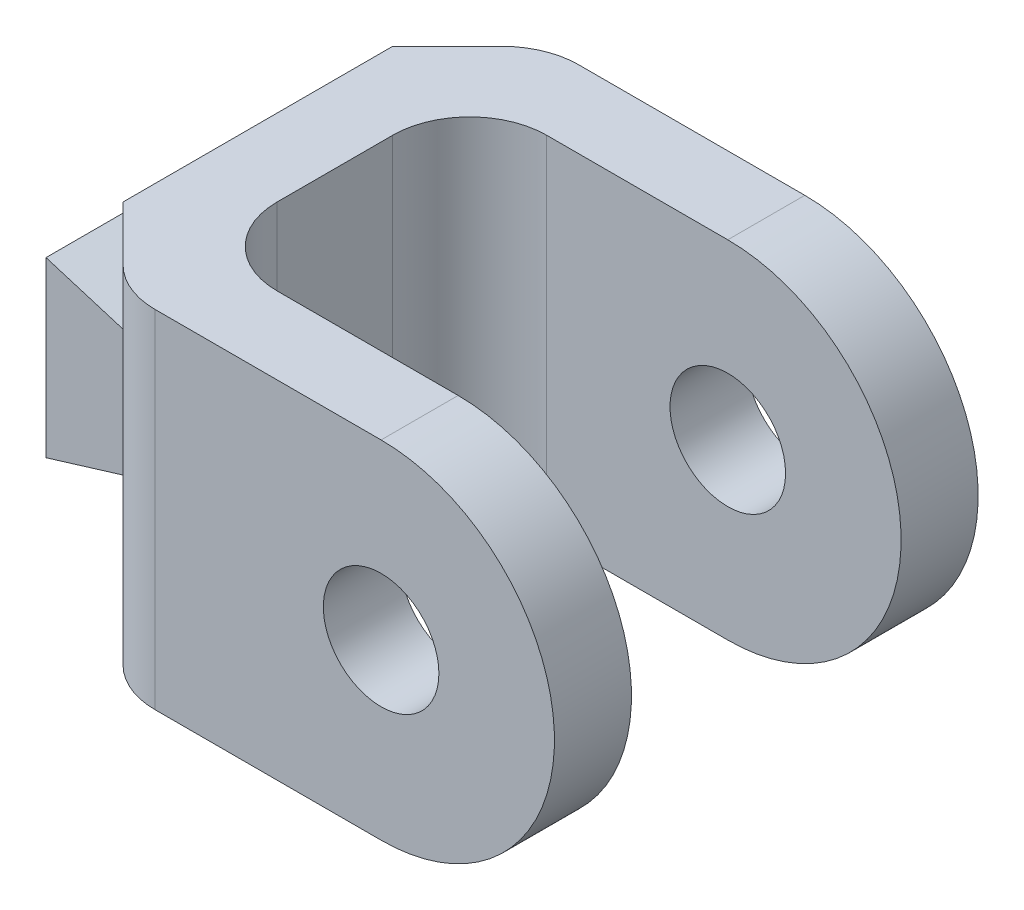
from build123d import *

# Parameters (mm, degrees)
BOSS_EXTRUDE2_DEPTH  = 7
SKETCH2_R            = 1.5
BOSS_EXTRUDE3_DEPTH  = 2
CUT_EXTRUDE3_DEPTH   = 18.442476888
FILLET1_R            = 2
FILLET2_R            = 2
FILLET2_OF_MIRROR2_R = 2
FILLET3_R            = 2


with BuildPart() as part:
    # Sketch1 → Boss-Extrude2 (new body)
    with BuildSketch(Plane.XY):
        Polygon((0, -1.64), (-2, -2.25), (-2, 2.25), (0, 1.64), (0, 4.5), (2, 4.5), (2, -4.5), (0, -4.5), align=None)
    boss_extrude2 = extrude(amount=BOSS_EXTRUDE2_DEPTH)

    # Sketch2 → Boss-Extrude3 (add)
    with BuildSketch(Plane.XY):
        with BuildLine():
            Line((0, 4.5), (8.7, 4.5))
            ThreePointArc((8.7, 4.5), (13.2, 0), (8.7, -4.5))
            Line((8.7, -4.5), (0, -4.5))
            Line((0, -4.5), (0, 4.5))
        make_face()
        with Locations((8.7, 0)):
            Circle(SKETCH2_R, mode=Mode.SUBTRACT)
    boss_extrude3 = extrude(amount=-BOSS_EXTRUDE3_DEPTH)

    # Sketch4 → Cut-Extrude3 (cut, through all)
    with BuildSketch(Plane(origin=(0, 4.5, 0), x_dir=(1, 0, 0), z_dir=(0, 1, 0))):
        Polygon((0, 0), (2, 2), (0, 2), align=None)
    cut_extrude3 = extrude(amount=-CUT_EXTRUDE3_DEPTH, mode=Mode.SUBTRACT)

    # Fillet1
    fillet1_edges = [part.edges().sort_by_distance(p)[0] for p in [
        (2, 0, 0),
    ]]
    fillet(fillet1_edges, radius=FILLET1_R)

    # Fillet2
    fillet2_edges = [part.edges().sort_by_distance(p)[0] for p in [
        (2, 0, -2),
    ]]
    fillet(fillet2_edges, radius=FILLET2_R)

    # Mirror2: Boss-Extrude2, Boss-Extrude3, Cut-Extrude3 across plane
    add(boss_extrude2.mirror(Plane.XY.offset(3.5)))
    add(boss_extrude3.mirror(Plane.XY.offset(3.5)))
    add(cut_extrude3.mirror(Plane.XY.offset(3.5)), mode=Mode.SUBTRACT)

    # Fillet2 of Mirror2
    fillet2_of_mirror2_edges = [part.edges().sort_by_distance(p)[0] for p in [
        (2, 0, 9),
    ]]
    fillet(fillet2_of_mirror2_edges, radius=FILLET2_OF_MIRROR2_R)

    # Fillet3
    fillet3_edges = [part.edges().sort_by_distance(p)[0] for p in [
        (2, 0, 7),
    ]]
    fillet(fillet3_edges, radius=FILLET3_R)


solid = part.part
